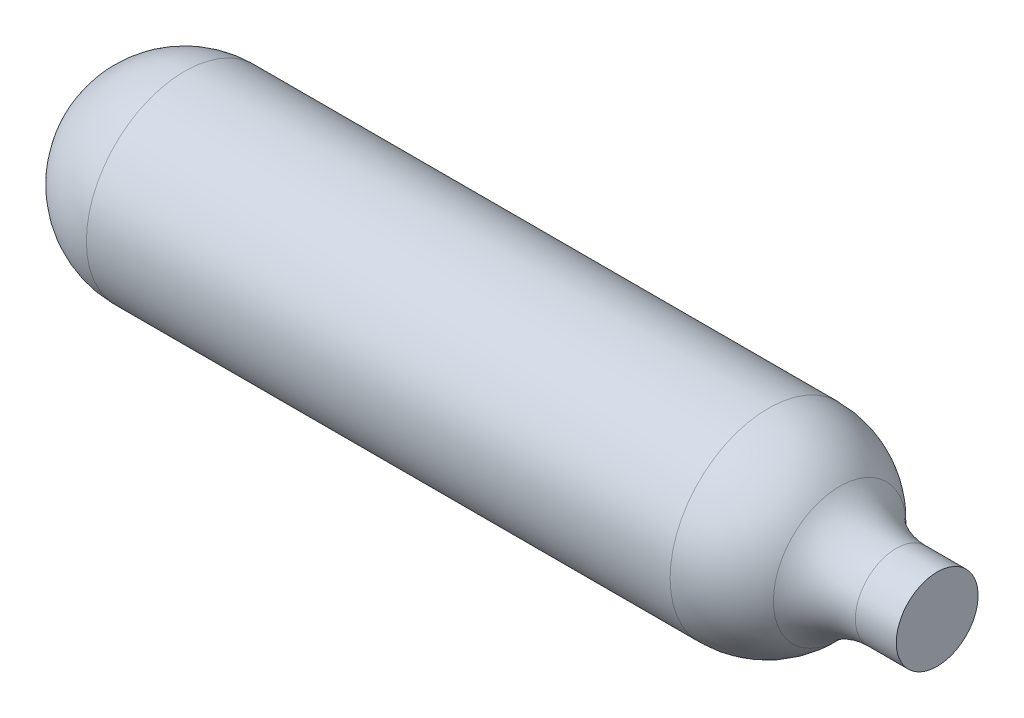
from build123d import *


with BuildPart() as part:
    # Sketch1 → Revolve1 (revolve)
    with BuildSketch(Plane.XY):
        with BuildLine():
            ThreePointArc((9.525, 9.525), (2.789807909, 6.735192091), (0, 0))
            Line((0, 0), (82.55, 0))
            Line((82.55, 0), (82.55, 3.96875))
            Line((82.55, 3.96875), (78.58125, 3.96875))
            ThreePointArc((78.58125, 3.96875), (75.571052406, 4.611408496), (73.085744926, 6.427323204))
            ThreePointArc((73.085744926, 6.427323204), (69.954384305, 8.715283085), (66.161688922, 9.525))
            Line((66.161688922, 9.525), (9.525, 9.525))
        make_face()
    revolve(axis=Axis((0, 0, 0), (1, 0, 0)))


solid = part.part
